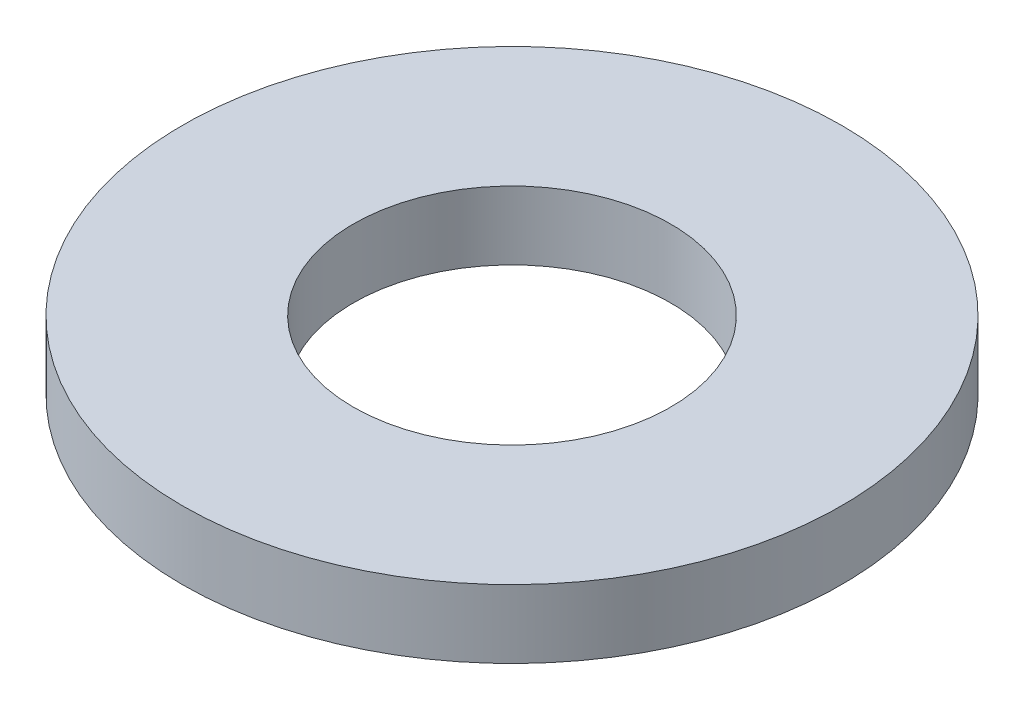
from build123d import *

# Parameters (mm, degrees)
SKETCH1_R           = 67.5
BOSS_EXTRUDE1_DEPTH = 14
SKETCH2_R           = 32.5
CUT_EXTRUDE1_DEPTH  = 97.480567992


with BuildPart() as part:
    # Sketch1 → Boss-Extrude1 (new body)
    with BuildSketch(Plane(origin=(0, 0, 0), x_dir=(1, 0, 0), z_dir=(0, 1, 0))):
        Circle(SKETCH1_R)
    extrude(amount=BOSS_EXTRUDE1_DEPTH)

    # Sketch2 → Cut-Extrude1 (cut, through all)
    with BuildSketch(Plane(origin=(0, 0, 0), x_dir=(1, 0, 0), z_dir=(0, 1, 0))):
        Circle(SKETCH2_R)
    extrude(amount=CUT_EXTRUDE1_DEPTH, mode=Mode.SUBTRACT)


solid = part.part
